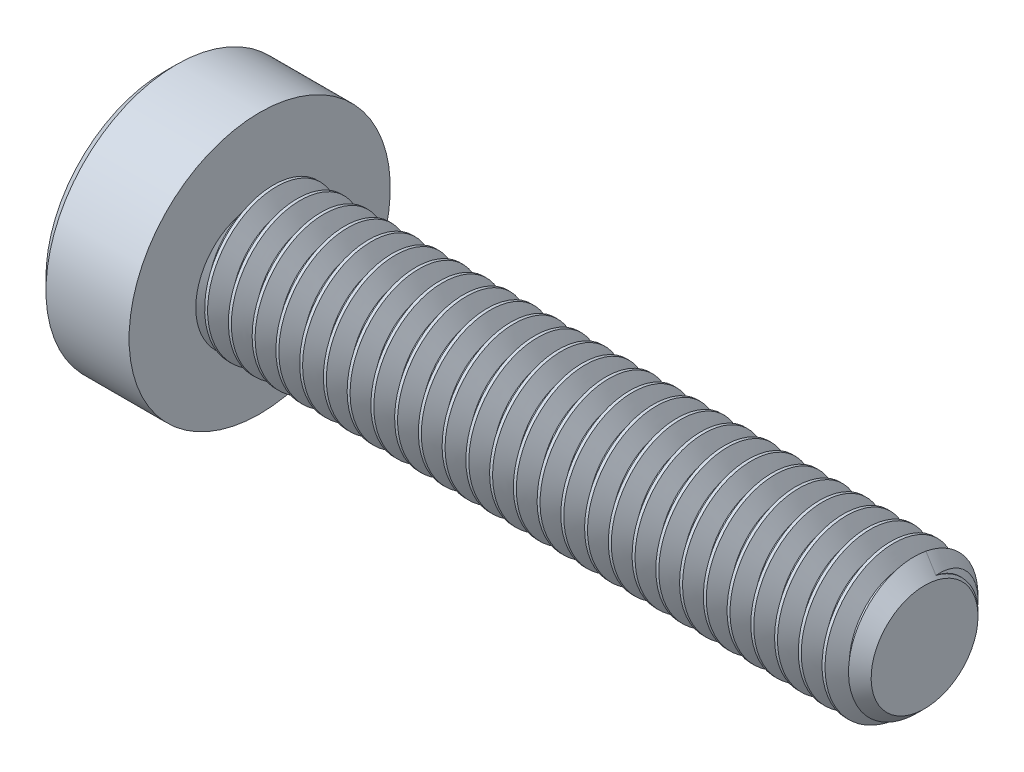
from build123d import *

# Parameters (mm, degrees)
SKETCH2_R           = 1.5
BOSS_EXTRUDE1_DEPTH = 14
CHAMFER1_SIZE       = 0.375
CUT_SWEEP1_PITCH    = 0.5
CUT_EXTRUDE1_DEPTH  = 1.62


with BuildPart() as part:
    # Sketch2 → Boss-Extrude1 (new body)
    with BuildSketch(Plane(origin=(7, 0, 0), x_dir=(0, 0, -1), z_dir=(1, 0, 0))):
        Circle(SKETCH2_R)
    extrude(amount=-BOSS_EXTRUDE1_DEPTH)

    # Chamfer1
    chamfer1_edges = [part.edges().sort_by_distance(p)[0] for p in [
        (7, 0, 1.5),
    ]]
    chamfer(chamfer1_edges, length=CHAMFER1_SIZE)

    # Cut-Sweep1: the profile of Sketch5 profile screwed along a right-hand helix of 29 turns, 6 arcs to a turn; built about Z, then put on its axis
    cut_sweep1_z = Axis((0, 0, 0), (0, 0, 1))
    cut_sweep1_corners = [(1.5003, 0, 0.218923205), (1.5003, 0, -0.218923205), (1.175240474, 0, -0.03125), (1.175240474, 0, 0.03125)]
    with BuildLine(mode=Mode.PRIVATE) as cut_sweep1_profile:
        Line(cut_sweep1_corners[0], cut_sweep1_corners[1])
        Line(cut_sweep1_corners[1], cut_sweep1_corners[2])
        Line(cut_sweep1_corners[2], cut_sweep1_corners[3])
        Line(cut_sweep1_corners[3], cut_sweep1_corners[0])
    cut_sweep1_cap = Face(cut_sweep1_profile.wire())
    cut_sweep1_turn_angles = [0, 30, 60, 90, 120, 150, 180, 210, 240, 270, 300, 330, 360]
    cut_sweep1_turn_weights = [1, 0.8660254037844387, 1, 0.8660254037844387, 1, 0.8660254037844387, 1, 0.8660254037844387, 1, 0.8660254037844387, 1, 0.8660254037844387, 1]
    cut_sweep1_turn_rails = [Edge.make_bspline([Vector(p[0], p[1], 0).rotate(cut_sweep1_z, cut_sweep1_turn_angles[k]) / cut_sweep1_turn_weights[k] + Vector(0, 0, p[2] + CUT_SWEEP1_PITCH * cut_sweep1_turn_angles[k] / 360) for k in range(13)], [0, 0, 0, 1, 1, 2, 2, 3, 3, 4, 4, 5, 5, 6, 6, 6], 2, cut_sweep1_turn_weights) for p in cut_sweep1_corners]
    cut_sweep1_turn_sides = [Face.make_surface_from_curves(cut_sweep1_turn_rails[p[0]], cut_sweep1_turn_rails[p[1]]) for p in [(0, 1), (1, 2), (2, 3), (3, 0)]]
    cut_sweep1 = Plane(origin=(7, 0, 0), x_dir=(0, 1, 0), z_dir=(-1, 0, 0)) * Solid(Shell([*[p.moved(Location((0, 0, CUT_SWEEP1_PITCH * i))) for i in range(29) for p in cut_sweep1_turn_sides], cut_sweep1_cap, cut_sweep1_cap.rotate(cut_sweep1_z, 10440).moved(Location((0, 0, CUT_SWEEP1_PITCH * 10440 / 360)))]))
    add(cut_sweep1, mode=Mode.SUBTRACT)

    # Sketch6 → Revolve1 (revolve)
    with BuildSketch(Plane.XY, mode=Mode.PRIVATE) as revolve1_sk:
        Polygon((-8.75, 2.75), (-9, 2.5), (-9, 0), (-7, 0), (-7, 2.75), align=None)
    revolve(revolve1_sk.sketch.rotate(Axis((-7, 0, 0), (-1, 0, 0)), 14.209880149), axis=Axis((-7, 0, 0), (-1, 0, 0)))

    # Sketch4 → Cut-Extrude1 (cut)
    with BuildSketch(Plane(origin=(-9, 0, 0), x_dir=(0, 0, -1), z_dir=(1, 0, 0))):
        Polygon((0, 1.154700538), (-1, 0.577350269), (-1, -0.577350269), (0, -1.154700538), (1, -0.577350269), (1, 0.577350269), align=None)
    extrude(amount=CUT_EXTRUDE1_DEPTH, mode=Mode.SUBTRACT)

    # Cut-Extrude2 cone 1 section (through the dimple's axis) → Cut-Extrude2 (revolve, cut)
    with BuildSketch(Plane(origin=(-9, 0, 0), x_dir=(0, 0, 1), z_dir=(0, 1, 0))):
        Polygon((0, 0), (1.154700538, 0), (0, 1.154700538), align=None)
    revolve(axis=Axis((-9, 0, 0), (1, 0, 0)), mode=Mode.SUBTRACT)


solid = part.part
